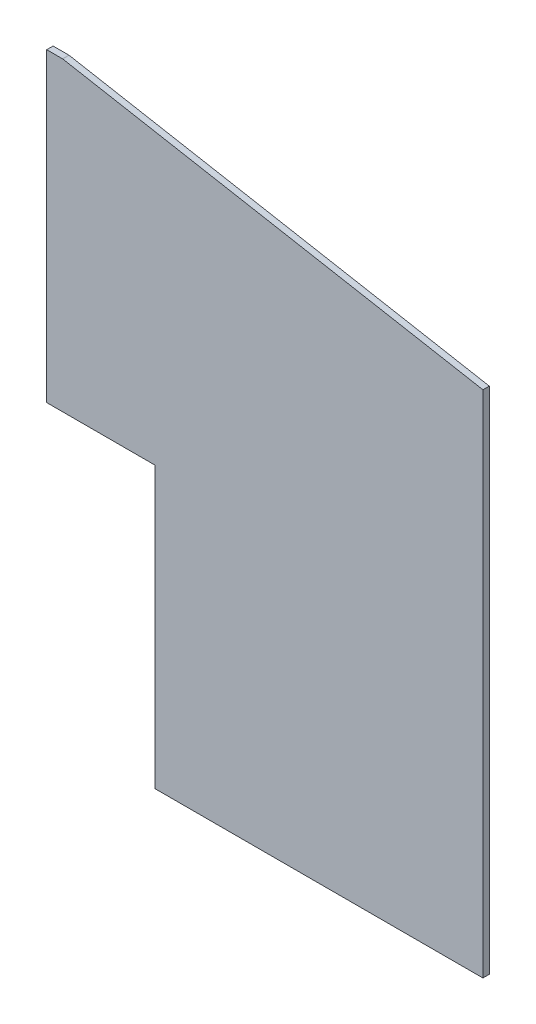
from build123d import *

# Parameters (mm, degrees)
TABAN_FLAN_1_DEPTH         = 10
KES_EKSTR_ZYON1_DEPTH      = 2664.925674639
KES_EKSTR_ZYON1_DEPTH_BACK = 2664.925674639
IZIM2_W                    = 1985
IZIM2_H                    = 440
KES_EKSTR_ZYON2_DEPTH      = 2664.925674639
KES_EKSTR_ZYON2_DEPTH_BACK = 2664.925674639
IZIM4_W                    = 2142.353076874
IZIM4_H                    = 1059.200267334
KES_EKSTR_ZYON3_DEPTH      = 2664.925674639
KES_EKSTR_ZYON3_DEPTH_BACK = 2664.925674639
IZIM5_W                    = 190.659324766
IZIM5_H                    = 598.86582779


# Sheet-metal steps are written as plain solids
with BuildPart() as part:
    # Çizim1 → Taban-Flanş1 (new body)
    with BuildSketch(Plane.XY):
        Polygon((0, 0), (0, 800), (660, 920), (1840, 920), (2500, 800), (2500, 0), align=None)
    extrude(amount=-TABAN_FLAN_1_DEPTH)

    # Çizim2 → Kes-Ekstrüzyon1 (cut, two sides: drawn at the far end of the back side and taken through both)
    with BuildSketch(Plane.XY.offset(-KES_EKSTR_ZYON1_DEPTH_BACK)):
        with Locations((992.5, 220)):
            Rectangle(IZIM2_W, IZIM2_H)
    extrude(amount=KES_EKSTR_ZYON1_DEPTH + KES_EKSTR_ZYON1_DEPTH_BACK, mode=Mode.SUBTRACT)

    # Çizim4 → Kes-Ekstrüzyon2 (cut, two sides: drawn at the far end of the back side and taken through both)
    with BuildSketch(Plane.XY.offset(-KES_EKSTR_ZYON2_DEPTH_BACK)):
        with Locations((741.823461563, 774.473780937)):
            Rectangle(IZIM4_W, IZIM4_H)
    extrude(amount=KES_EKSTR_ZYON2_DEPTH + KES_EKSTR_ZYON2_DEPTH_BACK, mode=Mode.SUBTRACT)

    # Çizim5 → Kes-Ekstrüzyon3 (cut, two sides: drawn at the far end of the back side and taken through both)
    with BuildSketch(Plane.XY.offset(-KES_EKSTR_ZYON3_DEPTH_BACK)):
        with Locations((1719.670337617, 680.404157963)):
            Rectangle(IZIM5_W, IZIM5_H)
    extrude(amount=KES_EKSTR_ZYON3_DEPTH + KES_EKSTR_ZYON3_DEPTH_BACK, mode=Mode.SUBTRACT)


solid = part.part
